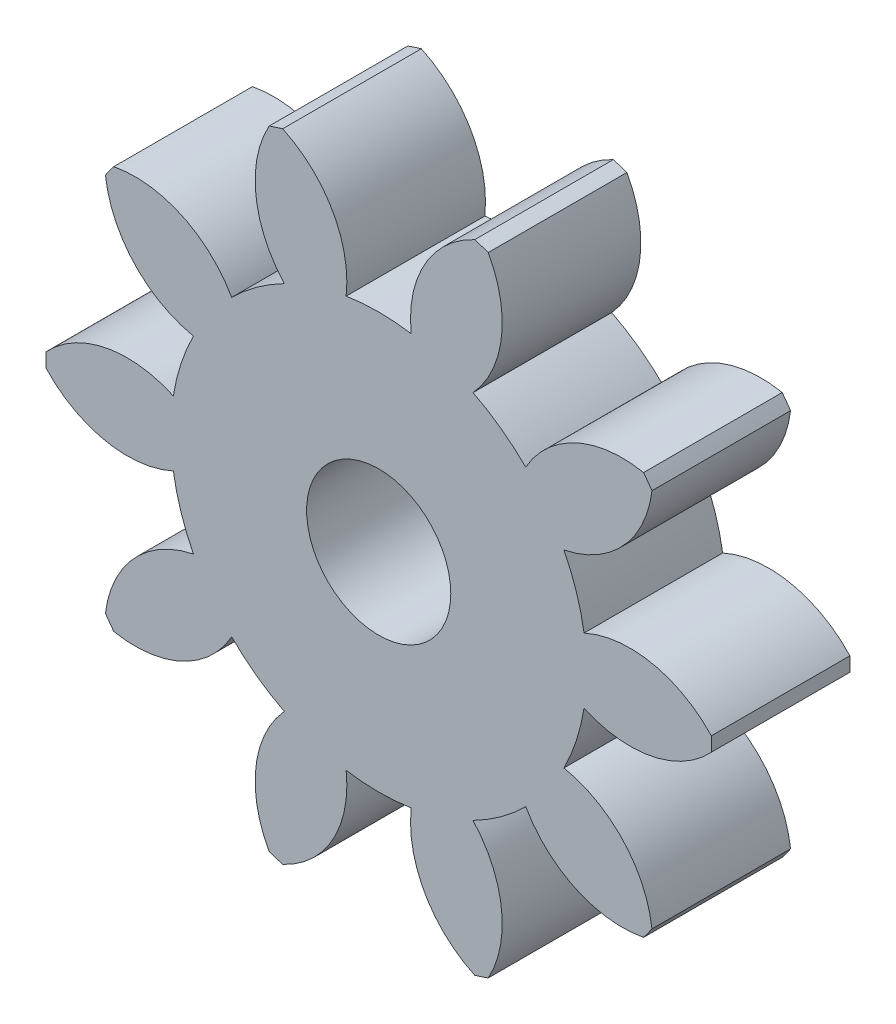
from build123d import *

# Parameters (mm, degrees)
BASPROSKE_W                      = 5
BASPROSKE_H                      = 12
TOOTHCUT_DEPTH                   = 18.691806013
TEETHCUTS_COUNT                  = 10
TEETHCUTS_ANGLE                  = 324
BORSKE_R                         = 2.5
BORE_DEPTH                       = 50.0000508
S_LIDO_MOVER_COPIAR1_START       = -12
S_LIDO_MOVER_COPIAR1_OUTLINE_W   = 5
S_LIDO_MOVER_COPIAR1_OUTLINE_H   = 26
S_LIDO_MOVER_COPIAR1_DEPTH       = 12
S_LIDO_MOVER_COPIAR1_START_2     = 5
S_LIDO_MOVER_COPIAR1_2_OUTLINE_W = 5
S_LIDO_MOVER_COPIAR1_2_OUTLINE_H = 26
S_LIDO_MOVER_COPIAR1_2_DEPTH     = 7
S_LIDO_MOVER_COPIAR1_3_DEPTH     = 5
S_LIDO_MOVER_COPIAR1_4_OUTLINE_R = 2.5
S_LIDO_MOVER_COPIAR1_4_DEPTH     = 5
CROQUIS1_R                       = 2.6
CORTAR_EXTRUIR2_DEPTH            = 22.118885154


# Read off the part's stored shape, not the designer's step: Sólido-Mover/Copiar1
with BuildPart() as part:
    # BasProSke → Base-Revolve (revolve)
    with BuildSketch(Plane(origin=(0, 0, 0), x_dir=(1, 0, 0), z_dir=(0, 1, 0)), mode=Mode.PRIVATE) as base_revolve_sk:
        with Locations((2.5, 6)):
            Rectangle(BASPROSKE_W, BASPROSKE_H)
    revolve(base_revolve_sk.sketch.rotate(Axis((-10, 0, 0), (1, 0, 0)), 180), axis=Axis((-10, 0, 0), (1, 0, 0)))

    # TooCutSke → ToothCut (cut, through all)
    with BuildSketch(Plane(origin=(0, 0, 0), x_dir=(0, 0, -1), z_dir=(1, 0, 0))):
        with BuildLine():
            ThreePointArc((1.173662691, 7.406586048), (0, 7.499), (-1.173662691, 7.406586048))
            ThreePointArc((-1.173662691, 7.406586048), (-1.668191438, 9.834565786), (-3.497907776, 11.50542856))
            ThreePointArc((-3.497907776, 11.50542856), (0, 12.0254), (3.497907776, 11.50542856))
            ThreePointArc((3.497907776, 11.50542856), (1.668191438, 9.834565786), (1.173662691, 7.406586048))
        make_face()
    toothcut = extrude(amount=TOOTHCUT_DEPTH, mode=Mode.SUBTRACT)

    # TeethCuts: ToothCut ×10 about axis
    teethcuts_axis = Axis((-10, 0, 0), (1, 0, 0))
    for i in range(1, TEETHCUTS_COUNT):
        add(toothcut.rotate(teethcuts_axis, i * TEETHCUTS_ANGLE / (TEETHCUTS_COUNT - 1)), mode=Mode.SUBTRACT)

    # BorSke → Bore (cut, symmetric)
    with BuildSketch(Plane(origin=(0, 0, 0), x_dir=(0, 0, -1), z_dir=(1, 0, 0))):
        with Locations(Location((0, 0, 0), (0, 0, 180))):
            Circle(BORSKE_R)
    extrude(amount=BORE_DEPTH, both=True, mode=Mode.SUBTRACT)

    # Sólido-Mover/Copiar1 outline → Sólido-Mover/Copiar1 (cut)
    with BuildSketch(Plane.XY.offset(S_LIDO_MOVER_COPIAR1_START)):
        with Locations((2.5, 0)):
            Rectangle(S_LIDO_MOVER_COPIAR1_OUTLINE_W, S_LIDO_MOVER_COPIAR1_OUTLINE_H)
    extrude(amount=S_LIDO_MOVER_COPIAR1_DEPTH, mode=Mode.SUBTRACT)

    # S_lido-Mover_Copiar1 2 outline → S_lido-Mover_Copiar1 2 (cut)
    with BuildSketch(Plane.XY.offset(S_LIDO_MOVER_COPIAR1_START_2)):
        with Locations((2.5, 0)):
            Rectangle(S_LIDO_MOVER_COPIAR1_2_OUTLINE_W, S_LIDO_MOVER_COPIAR1_2_OUTLINE_H)
    extrude(amount=S_LIDO_MOVER_COPIAR1_2_DEPTH, mode=Mode.SUBTRACT)

    # S_lido-Mover_Copiar1 3 outline → S_lido-Mover_Copiar1 3 (cut)
    with BuildSketch(Plane.XY):
        with BuildLine():
            Line((0, 13), (0, 5.588828232))
            ThreePointArc((0, 5.588828232), (0.762620659, 6.187052394), (1.596031014, 6.681915604))
            ThreePointArc((1.596031014, 6.681915604), (0.571180494, 8.917819898), (1.0483384, 11.330682707))
            ThreePointArc((1.0483384, 11.330682707), (1.291796067, 11.412678196), (1.536953197, 11.489443278))
            ThreePointArc((1.536953197, 11.489443278), (3.341227227, 9.817862641), (3.826337309, 7.406586048))
            ThreePointArc((3.826337309, 7.406586048), (4.411352302, 7.475860812), (5, 7.499))
            Line((5, 7.499), (5, 13))
            Line((5, 13), (0, 13))
        make_face()
        with BuildLine():
            ThreePointArc((1.596031014, -6.681915604), (0.762620659, -6.187052394), (0, -5.588828232))
            Line((0, -5.588828232), (0, -13))
            Line((0, -13), (5, -13))
            Line((5, -13), (5, -7.499))
            ThreePointArc((5, -7.499), (4.411352302, -7.475860812), (3.826337309, -7.406586048))
            ThreePointArc((3.826337309, -7.406586048), (3.341227227, -9.817862641), (1.536953197, -11.489443278))
            ThreePointArc((1.536953197, -11.489443278), (1.291796067, -11.412678196), (1.0483384, -11.330682707))
            ThreePointArc((1.0483384, -11.330682707), (0.571180494, -8.917819898), (1.596031014, -6.681915604))
        make_face()
        with BuildLine():
            Line((5, -2.5), (5, 2.5))
            ThreePointArc((5, 2.5), (2.5, 0), (5, -2.5))
        make_face()
    extrude(amount=S_LIDO_MOVER_COPIAR1_3_DEPTH, mode=Mode.SUBTRACT)

    # S_lido-Mover_Copiar1 4 outline → S_lido-Mover_Copiar1 4 (add)
    with BuildSketch(Plane.XY):
        with BuildLine():
            ThreePointArc((-2.406763642, 1.172541409), (-4.849931218, 1.456299749), (-6.997250213, 0.256880001))
            ThreePointArc((-6.997250213, 0.256880001), (-7, 0), (-6.997250213, -0.256880001))
            ThreePointArc((-6.997250213, -0.256880001), (-4.849931218, -1.456299749), (-2.406763642, -1.172541409))
            ThreePointArc((-2.406763642, -1.172541409), (-2.131972816, -2.317318441), (-1.681400207, -3.404980509))
            ThreePointArc((-1.681400207, -3.404980509), (-3.824753264, -4.61147306), (-4.856969584, -6.843986457))
            ThreePointArc((-4.856969584, -6.843986457), (-4.708203933, -7.053423027), (-4.554989032, -7.259627029))
            ThreePointArc((-4.554989032, -7.259627029), (-2.112770233, -6.967815552), (-0.302995112, -5.302192362))
            ThreePointArc((-0.302995112, -5.302192362), (0.592198393, -6.066818441), (1.596031014, -6.681915604))
            ThreePointArc((1.596031014, -6.681915604), (0.571180494, -8.917819898), (1.0483384, -11.330682707))
            ThreePointArc((1.0483384, -11.330682707), (1.291796067, -11.412678196), (1.536953197, -11.489443278))
            ThreePointArc((1.536953197, -11.489443278), (3.341227227, -9.817862641), (3.826337309, -7.406586048))
            ThreePointArc((3.826337309, -7.406586048), (5, -7.499), (6.173662691, -7.406586048))
            ThreePointArc((6.173662691, -7.406586048), (6.658772773, -9.817862641), (8.463046803, -11.489443278))
            ThreePointArc((8.463046803, -11.489443278), (8.708203933, -11.412678196), (8.9516616, -11.330682707))
            ThreePointArc((8.9516616, -11.330682707), (9.428819506, -8.917819898), (8.403968986, -6.681915604))
            ThreePointArc((8.403968986, -6.681915604), (9.407801607, -6.066818441), (10.302995112, -5.302192362))
            ThreePointArc((10.302995112, -5.302192362), (12.112770233, -6.967815552), (14.554989032, -7.259627029))
            ThreePointArc((14.554989032, -7.259627029), (14.708203933, -7.053423027), (14.856969584, -6.843986457))
            ThreePointArc((14.856969584, -6.843986457), (13.824753264, -4.61147306), (11.681400207, -3.404980509))
            ThreePointArc((11.681400207, -3.404980509), (12.131972816, -2.317318441), (12.406763642, -1.172541409))
            ThreePointArc((12.406763642, -1.172541409), (14.849931218, -1.456299749), (16.997250213, -0.256880001))
            ThreePointArc((16.997250213, -0.256880001), (17, 0), (16.997250213, 0.256880001))
            ThreePointArc((16.997250213, 0.256880001), (14.849931218, 1.456299749), (12.406763642, 1.172541409))
            ThreePointArc((12.406763642, 1.172541409), (12.131972816, 2.317318441), (11.681400207, 3.404980509))
            ThreePointArc((11.681400207, 3.404980509), (13.824753264, 4.61147306), (14.856969584, 6.843986457))
            ThreePointArc((14.856969584, 6.843986457), (14.708203933, 7.053423027), (14.554989032, 7.259627029))
            ThreePointArc((14.554989032, 7.259627029), (12.112770233, 6.967815552), (10.302995112, 5.302192362))
            ThreePointArc((10.302995112, 5.302192362), (9.407801607, 6.066818441), (8.403968986, 6.681915604))
            ThreePointArc((8.403968986, 6.681915604), (9.428819506, 8.917819898), (8.9516616, 11.330682707))
            ThreePointArc((8.9516616, 11.330682707), (8.708203933, 11.412678196), (8.463046803, 11.489443278))
            ThreePointArc((8.463046803, 11.489443278), (6.658772773, 9.817862641), (6.173662691, 7.406586048))
            ThreePointArc((6.173662691, 7.406586048), (5, 7.499), (3.826337309, 7.406586048))
            ThreePointArc((3.826337309, 7.406586048), (3.341227227, 9.817862641), (1.536953197, 11.489443278))
            ThreePointArc((1.536953197, 11.489443278), (1.291796067, 11.412678196), (1.0483384, 11.330682707))
            ThreePointArc((1.0483384, 11.330682707), (0.571180494, 8.917819898), (1.596031014, 6.681915604))
            ThreePointArc((1.596031014, 6.681915604), (0.592198393, 6.066818441), (-0.302995112, 5.302192362))
            ThreePointArc((-0.302995112, 5.302192362), (-2.112770233, 6.967815552), (-4.554989032, 7.259627029))
            ThreePointArc((-4.554989032, 7.259627029), (-4.708203933, 7.053423027), (-4.856969584, 6.843986457))
            ThreePointArc((-4.856969584, 6.843986457), (-3.824753264, 4.61147306), (-1.681400207, 3.404980509))
            ThreePointArc((-1.681400207, 3.404980509), (-2.131972816, 2.317318441), (-2.406763642, 1.172541409))
        make_face()
        with Locations((5, 0)):
            Circle(S_LIDO_MOVER_COPIAR1_4_OUTLINE_R, mode=Mode.SUBTRACT)
    extrude(amount=S_LIDO_MOVER_COPIAR1_4_DEPTH)

    # Croquis1 → Cortar-Extruir2 (cut, through all)
    with BuildSketch(Plane.XY.offset(5)):
        with Locations((5, 0)):
            Circle(CROQUIS1_R)
    extrude(amount=-CORTAR_EXTRUIR2_DEPTH, mode=Mode.SUBTRACT)


solid = part.part
